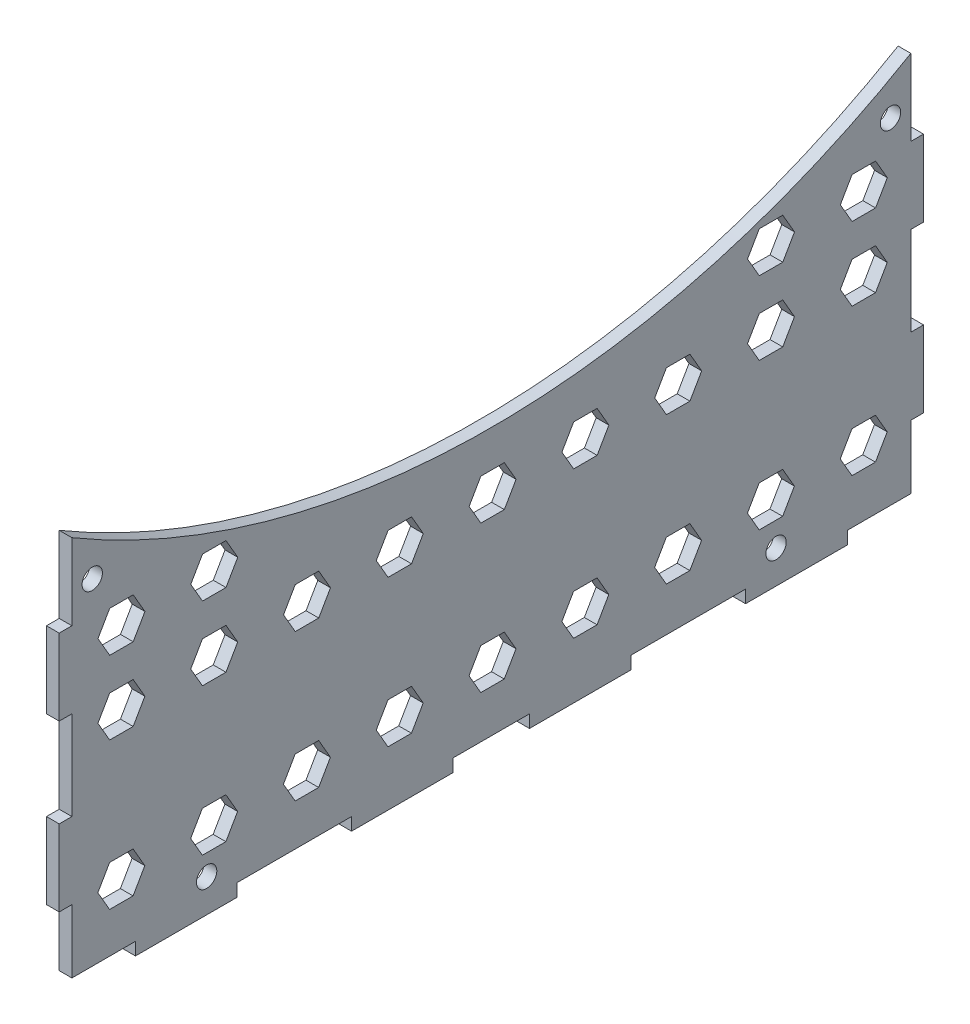
from build123d import *

# Parameters (mm, degrees)
STOCK_VAHEKATUS_1_START     = -2.5
STOCK_VAHEKATUS_1_OUTLINE_R = 2
STOCK_VAHEKATUS_1_DEPTH     = 2.5
SKETCH1_W                   = 165
SKETCH1_H                   = 2
BOSS_EXTRUDE1_DEPTH         = 2
FILLET1_R                   = 5


# Read off the part's stored shape, not the designer's step: Stock-Vahekatus-1
with BuildPart() as part:
    # Stock-Vahekatus-1 outline → Stock-Vahekatus-1 (new body)
    with BuildSketch(Plane.YZ.offset(STOCK_VAHEKATUS_1_START)):
        with BuildLine():
            Line((34.75, 2.5), (19.75, 2.5))
            Line((19.75, 2.5), (19.75, 0))
            Line((19.75, 0), (2.25, 0))
            Line((2.25, 0), (2.25, 2.5))
            Line((2.25, 2.5), (-12.75, 2.5))
            Line((-12.75, 2.5), (-12.75, 0))
            Line((-12.75, 0), (-25.25, 0))
            Line((-25.25, 0), (-25.25, -12.5))
            Line((-25.25, -12.5), (-27.75, -12.5))
            Line((-27.75, -12.5), (-27.75, -32.5))
            Line((-27.75, -32.5), (-25.25, -32.5))
            Line((-25.25, -32.5), (-25.25, -55))
            Line((-25.25, -55), (-27.75, -55))
            Line((-27.75, -55), (-27.75, -75))
            Line((-27.75, -75), (-25.25, -75))
            Line((-25.25, -75), (-25.25, -90))
            Line((-25.25, -90), (-27.75, -90))
            Line((-27.75, -90), (-27.75, -110))
            Line((-27.75, -110), (-25.25, -110))
            Line((-25.25, -110), (-25.25, -132.5))
            Line((-25.25, -132.5), (-27.75, -132.5))
            Line((-27.75, -132.5), (-27.75, -152.5))
            Line((-27.75, -152.5), (-25.25, -152.5))
            Line((-25.25, -152.5), (-25.25, -165))
            Line((-25.25, -165), (-12.75, -165))
            Line((-12.75, -165), (-12.75, -167.5))
            Line((-12.75, -167.5), (2.25, -167.5))
            Line((2.25, -167.5), (2.25, -165))
            Line((2.25, -165), (19.75, -165))
            Line((19.75, -165), (19.75, -167.5))
            Line((19.75, -167.5), (34.75, -167.5))
            Line((34.75, -167.5), (34.75, -165))
            Line((34.75, -165), (49.75, -165))
            ThreePointArc((49.75, -165), (27.258972557, -82.5), (49.75, 0))
            Line((49.75, 0), (34.75, 0))
            Line((34.75, 0), (34.75, 2.5))
        make_face()
        Polygon((-16.400344461, -158.043949472), (-16.400344461, -153.425147318), (-12.400344461, -151.115746241), (-8.400344461, -153.425147318), (-8.400344461, -158.043949472), (-12.400344461, -160.353350548), align=None, mode=Mode.SUBTRACT)
        with Locations((-21.25, -138.5)):
            Circle(STOCK_VAHEKATUS_1_OUTLINE_R, mode=Mode.SUBTRACT)
        Polygon((-16.51055957, -139.792388723), (-16.51055957, -135.173586569), (-12.51055957, -132.864185493), (-8.51055957, -135.173586569), (-8.51055957, -139.792388723), (-12.51055957, -142.1017898), align=None, mode=Mode.SUBTRACT)
        Polygon((-16.62077468, -121.540827974), (-16.62077468, -116.922025821), (-12.62077468, -114.612624744), (-8.62077468, -116.922025821), (-8.62077468, -121.540827974), (-12.62077468, -123.850229051), align=None, mode=Mode.SUBTRACT)
        Polygon((-16.73098979, -103.289267225), (-16.73098979, -98.670465072), (-12.73098979, -96.361063995), (-8.73098979, -98.670465072), (-8.73098979, -103.289267225), (-12.73098979, -105.598668302), align=None, mode=Mode.SUBTRACT)
        Polygon((-16.841204899, -85.037706477), (-16.841204899, -80.418904323), (-12.841204899, -78.109503246), (-8.841204899, -80.418904323), (-8.841204899, -85.037706477), (-12.841204899, -87.347107553), align=None, mode=Mode.SUBTRACT)
        Polygon((12.45259109, -158.059235345), (12.45259109, -153.440433192), (16.45259109, -151.131032115), (20.45259109, -153.440433192), (20.45259109, -158.059235345), (16.45259109, -160.368636422), align=None, mode=Mode.SUBTRACT)
        Polygon((12.34237598, -139.807674597), (12.34237598, -135.188872443), (16.34237598, -132.879471366), (20.34237598, -135.188872443), (20.34237598, -139.807674597), (16.34237598, -142.117075673), align=None, mode=Mode.SUBTRACT)
        Polygon((26.879058865, -158.066878282), (26.879058865, -153.448076129), (30.879058865, -151.138675052), (34.879058865, -153.448076129), (34.879058865, -158.066878282), (30.879058865, -160.376279359), align=None, mode=Mode.SUBTRACT)
        with Locations((40.75, -161)):
            Circle(STOCK_VAHEKATUS_1_OUTLINE_R, mode=Mode.SUBTRACT)
        Polygon((26.768843755, -139.815317533), (26.768843755, -135.19651538), (30.768843755, -132.887114303), (34.768843755, -135.19651538), (34.768843755, -139.815317533), (30.768843755, -142.12471861), align=None, mode=Mode.SUBTRACT)
        Polygon((12.23216087, -121.556113848), (12.23216087, -116.937311694), (16.23216087, -114.627910618), (20.23216087, -116.937311694), (20.23216087, -121.556113848), (16.23216087, -123.865514925), align=None, mode=Mode.SUBTRACT)
        Polygon((12.121945761, -103.304553099), (12.121945761, -98.685750946), (16.121945761, -96.376349869), (20.121945761, -98.685750946), (20.121945761, -103.304553099), (16.121945761, -105.613954176), align=None, mode=Mode.SUBTRACT)
        Polygon((12.011730651, -85.05299235), (12.011730651, -80.434190197), (16.011730651, -78.12478912), (20.011730651, -80.434190197), (20.011730651, -85.05299235), (16.011730651, -87.362393427), align=None, mode=Mode.SUBTRACT)
        Polygon((-16.951420009, -66.786145728), (-16.951420009, -62.167343574), (-12.951420009, -59.857942498), (-8.951420009, -62.167343574), (-8.951420009, -66.786145728), (-12.951420009, -69.095546805), align=None, mode=Mode.SUBTRACT)
        Polygon((-17.061635119, -48.534584979), (-17.061635119, -43.915782826), (-13.061635119, -41.606381749), (-9.061635119, -43.915782826), (-9.061635119, -48.534584979), (-13.061635119, -50.843986056), align=None, mode=Mode.SUBTRACT)
        with Locations((-21.25, -26.5)):
            Circle(STOCK_VAHEKATUS_1_OUTLINE_R, mode=Mode.SUBTRACT)
        Polygon((-17.171850228, -30.283024231), (-17.171850228, -25.664222077), (-13.171850228, -23.354821), (-9.171850228, -25.664222077), (-9.171850228, -30.283024231), (-13.171850228, -32.592425307), align=None, mode=Mode.SUBTRACT)
        Polygon((-17.282065338, -12.031463482), (-17.282065338, -7.412661328), (-13.282065338, -5.103260252), (-9.282065338, -7.412661328), (-9.282065338, -12.031463482), (-13.282065338, -14.340864559), align=None, mode=Mode.SUBTRACT)
        Polygon((11.901515541, -66.801431602), (11.901515541, -62.182629448), (15.901515541, -59.873228371), (19.901515541, -62.182629448), (19.901515541, -66.801431602), (15.901515541, -69.110832679), align=None, mode=Mode.SUBTRACT)
        Polygon((11.791300432, -48.549870853), (11.791300432, -43.9310687), (15.791300432, -41.621667623), (19.791300432, -43.9310687), (19.791300432, -48.549870853), (15.791300432, -50.85927193), align=None, mode=Mode.SUBTRACT)
        Polygon((11.681085322, -30.298310104), (11.681085322, -25.679507951), (15.681085322, -23.370106874), (19.681085322, -25.679507951), (19.681085322, -30.298310104), (15.681085322, -32.607711181), align=None, mode=Mode.SUBTRACT)
        Polygon((26.107553097, -30.305953041), (26.107553097, -25.687150888), (30.107553097, -23.377749811), (34.107553097, -25.687150888), (34.107553097, -30.305953041), (30.107553097, -32.615354118), align=None, mode=Mode.SUBTRACT)
        Polygon((11.570870212, -12.046749356), (11.570870212, -7.427947202), (15.570870212, -5.118546125), (19.570870212, -7.427947202), (19.570870212, -12.046749356), (15.570870212, -14.356150432), align=None, mode=Mode.SUBTRACT)
        Polygon((25.997337988, -12.054392293), (25.997337988, -7.435590139), (29.997337988, -5.126189062), (33.997337988, -7.435590139), (33.997337988, -12.054392293), (29.997337988, -14.363793369), align=None, mode=Mode.SUBTRACT)
        with Locations((40.75, -4)):
            Circle(STOCK_VAHEKATUS_1_OUTLINE_R, mode=Mode.SUBTRACT)
    extrude(amount=STOCK_VAHEKATUS_1_DEPTH)

    # Sketch1 → Boss-Extrude1 (add)
    with BuildSketch(Plane.ZY.offset(2.5)):
        with Locations((-82.5, -1.25)):
            Rectangle(SKETCH1_W, SKETCH1_H)
    extrude(amount=BOSS_EXTRUDE1_DEPTH)

    # Fillet1
    # the kernel refuses this fillet: 5 mm, written as the material it adds along each edge
    with BuildSketch(Plane(origin=(-2.5, -2.25, -165), x_dir=(0, -1, 0), z_dir=(0, 0, 1))) as fillet1_piece_1:
        with BuildLine():
            CenterArc((4, -5), FILLET1_R, 90, 53.130102354)
            Line((0, -2), (-0.08, -1.94))
            ThreePointArc((-0.08, -1.94), (-0.1, -1), (-0.1, 0))
            Line((-0.1, 0), (0, 0.1))
            Line((0, 0.1), (4, 0.1))
            Line((4, 0.1), (4, 0))
        make_face()
    extrude(amount=165)


solid = part.part
